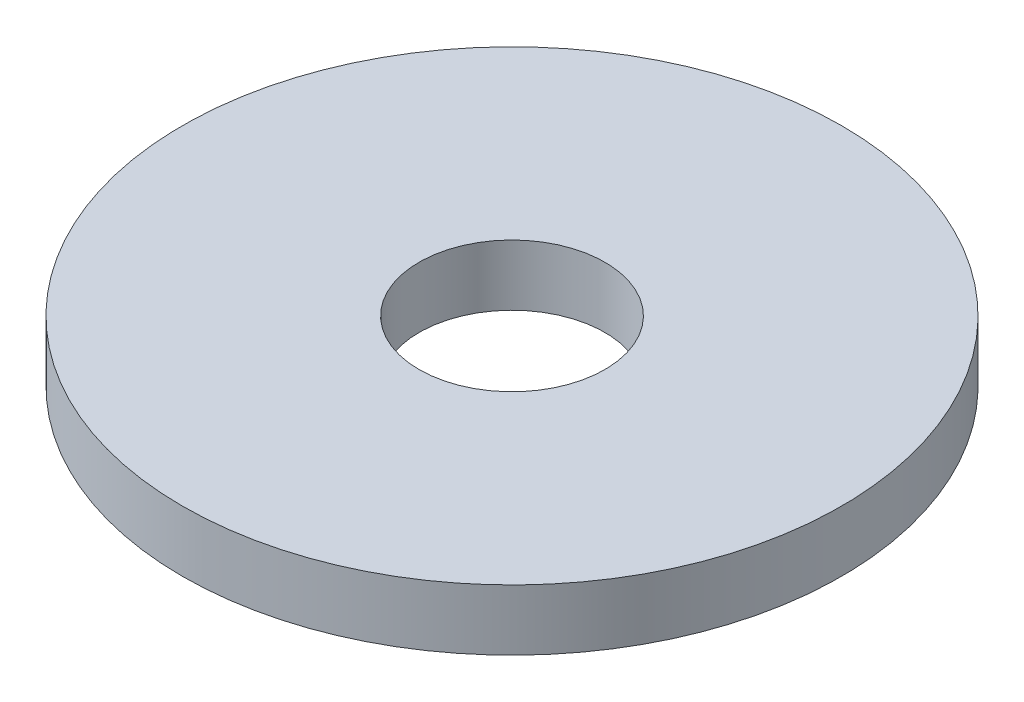
from build123d import *

# Parameters (mm, degrees)
SKETCH1_R           = 97.5
BOSS_EXTRUDE1_DEPTH = 18
SKETCH2_R           = 27.5
CUT_EXTRUDE1_DEPTH  = 140.055744218


with BuildPart() as part:
    # Sketch1 → Boss-Extrude1 (new body)
    with BuildSketch(Plane(origin=(0, 0, 0), x_dir=(1, 0, 0), z_dir=(0, 1, 0))):
        Circle(SKETCH1_R)
    extrude(amount=BOSS_EXTRUDE1_DEPTH)

    # Sketch2 → Cut-Extrude1 (cut, through all)
    with BuildSketch(Plane(origin=(0, 0, 0), x_dir=(1, 0, 0), z_dir=(0, 1, 0))):
        Circle(SKETCH2_R)
    extrude(amount=CUT_EXTRUDE1_DEPTH, mode=Mode.SUBTRACT)


solid = part.part
